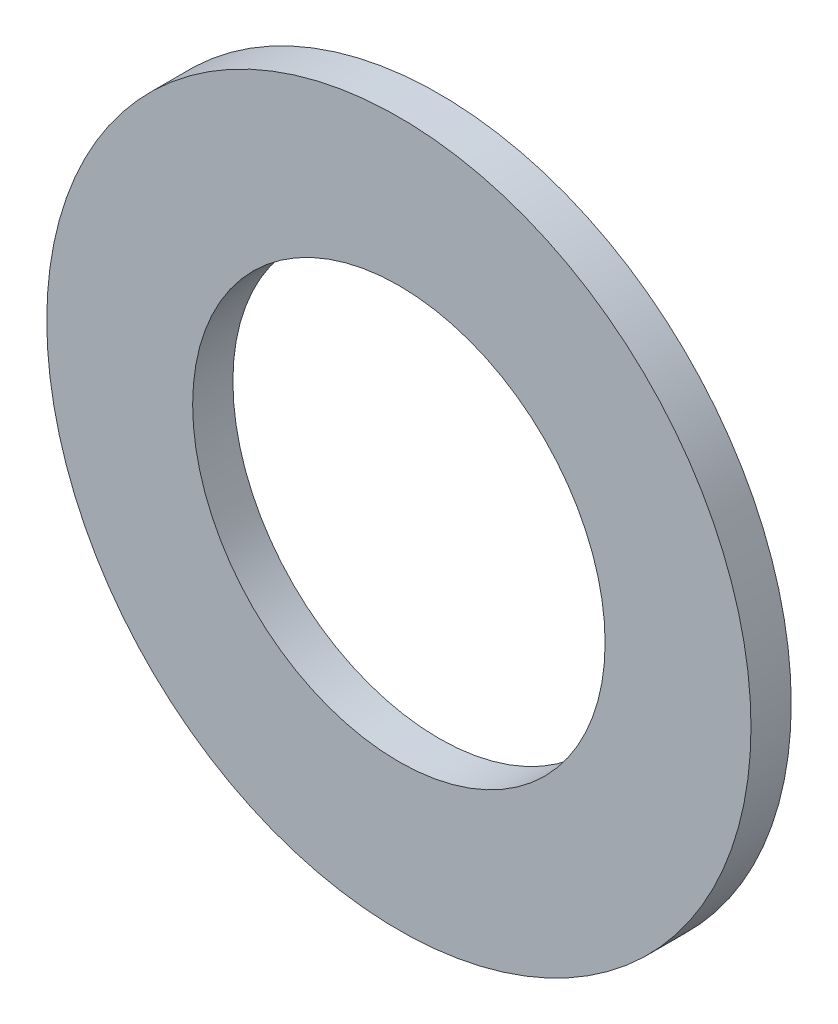
from build123d import *

# Parameters (mm, degrees)
SKETCH1_R           = 7
SKETCH1_R_2         = 4.1
BOSS_EXTRUDE1_DEPTH = 0.8


with BuildPart() as part:
    # Sketch1 → Boss-Extrude1 (new body)
    with BuildSketch(Plane.XY):
        Circle(SKETCH1_R)
        Circle(SKETCH1_R_2, mode=Mode.SUBTRACT)
    extrude(amount=BOSS_EXTRUDE1_DEPTH)


solid = part.part
